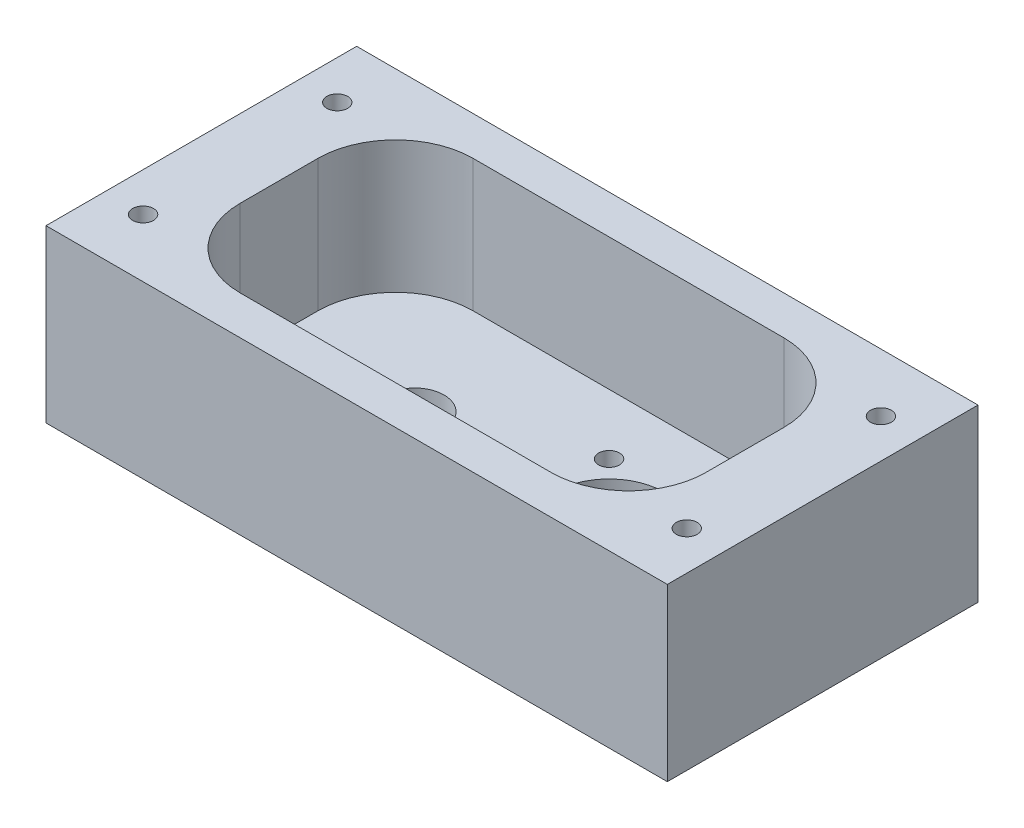
from build123d import *

# Parameters (mm, degrees)
SKETCH1_W            = 101.6
SKETCH1_H            = 50.8
BOSS_EXTRUDE1_DEPTH  = 27.94
SKETCH2_R            = 4.7625
SKETCH2_R_2          = 9
CUT_EXTRUDE1_DEPTH   = 64.296473835
CUT_EXTRUDE2_DEPTH   = 21.59
M3_CLEARANCE_HOLE1_D = 3.4


with BuildPart() as part:
    # Sketch1 → Boss-Extrude1 (new body)
    with BuildSketch(Plane(origin=(0, 0, 0), x_dir=(1, 0, 0), z_dir=(0, 1, 0))):
        Rectangle(SKETCH1_W, SKETCH1_H)
    extrude(amount=BOSS_EXTRUDE1_DEPTH)

    # Sketch2 → Cut-Extrude1 (cut, through all)
    with BuildSketch(Plane.XZ):
        with Locations((-15.875, 0)):
            Circle(SKETCH2_R)
        with Locations((15.875, 0)):
            Circle(SKETCH2_R_2)
    extrude(amount=-CUT_EXTRUDE1_DEPTH, mode=Mode.SUBTRACT)

    # Sketch3 → Cut-Extrude2 (cut)
    with BuildSketch(Plane(origin=(0, 27.94, 0), x_dir=(1, 0, 0), z_dir=(0, 1, 0))):
        with BuildLine():
            Line((-25.4, -19.05), (25.4, -19.05))
            ThreePointArc((25.4, -19.05), (34.380256121, -15.330256121), (38.1, -6.35))
            Line((38.1, -6.35), (38.1, 6.35))
            ThreePointArc((38.1, 6.35), (34.380256121, 15.330256121), (25.4, 19.05))
            Line((25.4, 19.05), (-25.4, 19.05))
            ThreePointArc((-25.4, 19.05), (-34.380256121, 15.330256121), (-38.1, 6.35))
            Line((-38.1, 6.35), (-38.1, -6.35))
            ThreePointArc((-38.1, -6.35), (-34.380256121, -15.330256121), (-25.4, -19.05))
        make_face()
    extrude(amount=-CUT_EXTRUDE2_DEPTH, mode=Mode.SUBTRACT)

    # M3 Clearance Hole1 (through all)
    with Locations(Plane(origin=(-44.45, 0, 15.875), x_dir=(0, 0, -1), z_dir=(0, -1, 0))):
        with Locations((0, 0), (31.75, 0), (6.682611845, 51.132611845), (25.067388155, 51.132611845), (6.682611845, 69.517388155), (25.067388155, 69.517388155), (0, 88.9), (31.75, 88.9)):
            Hole(M3_CLEARANCE_HOLE1_D / 2)


solid = part.part
